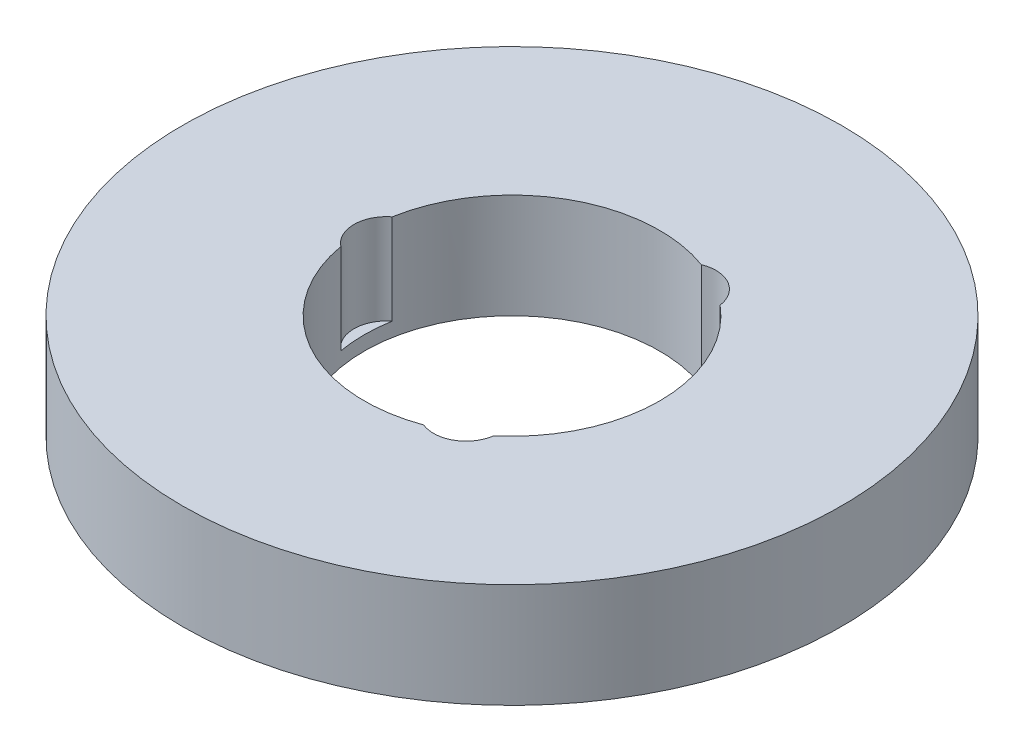
from build123d import *

# Parameters (mm, degrees)
SKETCH1_R           = 72.5
BOSS_EXTRUDE1_DEPTH = 23
SKETCH2_R           = 32.5
CUT_EXTRUDE1_DEPTH  = 106.078542053
SKETCH3_R           = 7.160163636
CUT_EXTRUDE2_DEPTH  = 19.879712935
CIRPATTERN1_COUNT   = 3


with BuildPart() as part:
    # Sketch1 → Boss-Extrude1 (new body)
    with BuildSketch(Plane(origin=(0, 0, 0), x_dir=(1, 0, 0), z_dir=(0, 1, 0))):
        Circle(SKETCH1_R)
    extrude(amount=BOSS_EXTRUDE1_DEPTH)

    # Sketch2 → Cut-Extrude1 (cut, through all)
    with BuildSketch(Plane(origin=(0, 0, 0), x_dir=(1, 0, 0), z_dir=(0, 1, 0))):
        Circle(SKETCH2_R)
    extrude(amount=CUT_EXTRUDE1_DEPTH, mode=Mode.SUBTRACT)

    # Sketch3 → Cut-Extrude2 (cut)
    with BuildSketch(Plane(origin=(0, 23, 0), x_dir=(1, 0, 0), z_dir=(0, 1, 0))):
        with Locations((-27.605143873, 0)):
            Circle(SKETCH3_R)
    cut_extrude2 = extrude(amount=-CUT_EXTRUDE2_DEPTH, mode=Mode.SUBTRACT)

    # CirPattern1: Cut-Extrude2 ×3 about axis
    cirpattern1_axis = Axis((0, 0, 0), (0, 1, 0))
    for i in range(1, CIRPATTERN1_COUNT):
        add(cut_extrude2.rotate(cirpattern1_axis, i * 360 / CIRPATTERN1_COUNT), mode=Mode.SUBTRACT)


solid = part.part
